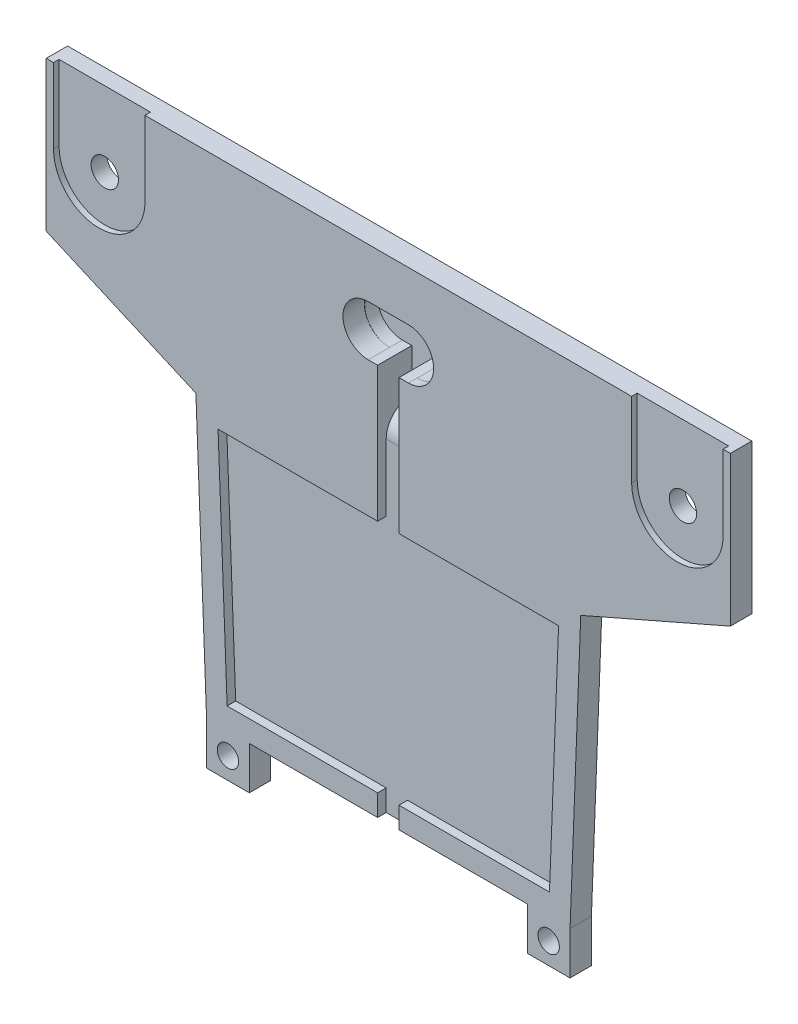
from build123d import *

# Parameters (mm, degrees)
MAIN_BODY_DEPTH          = 6.35
BATTERY_SPACING_DEPTH    = 2.54
SKETCH8_R                = 4.064
LIGHT_SOCKETS_DEPTH      = 12.7
LIGHT_LEADS_POCKET_DEPTH = 6.35
WIRE_TRAIL_DEPTH         = 2.54
LEAD_ROOM_DEPTH          = 7.62
FILLET1_R                = 7.62
TAB_SLOTS_DEPTH          = 1.651
SKETCH14_W               = 12.7
SKETCH14_H               = 6.35
SCREW_MOUNT_DEPTH        = 12.7
CUT_EXTRUDE1_DEPTH       = 179.026641265
CUT_EXTRUDE1_DEPTH_BACK  = 179.026641265
SKETCH15_R               = 3.175


# Sheet-metal steps are written as plain solids
with BuildPart() as part:
    # Sketch1 → Main Body (new body)
    with BuildSketch(Plane.XY):
        Polygon((-53.975, 0), (53.975, 0), (57.15, 82.161327118), (101.6, 101.6), (101.6, 146.05), (-101.6, 146.05), (-101.6, 101.6), (-57.15, 82.161327118), align=None)
    extrude(amount=-MAIN_BODY_DEPTH)

    # Sketch7 → Battery Spacing (cut)
    with BuildSketch(Plane.XY):
        Polygon((-50.564894027, 76.2), (-47.86564661, 6.35), (47.86564661, 6.35), (50.564894027, 76.2), align=None)
    extrude(amount=-BATTERY_SPACING_DEPTH, mode=Mode.SUBTRACT)

    # Sketch8 → Light Sockets (cut)
    with BuildSketch(Plane.XY):
        with Locations((85.852, 123.825)):
            Circle(SKETCH8_R)
        with Locations((-85.852, 123.825)):
            Circle(SKETCH8_R)
        with BuildLine():
            Line((-5.969, 131.318), (5.969, 131.318))
            ThreePointArc((5.969, 131.318), (13.462, 123.825), (5.969, 116.332))
            Line((5.969, 116.332), (-5.969, 116.332))
            ThreePointArc((-5.969, 116.332), (-13.462, 123.825), (-5.969, 131.318))
        make_face()
    extrude(amount=-LIGHT_SOCKETS_DEPTH, mode=Mode.SUBTRACT)

    # Sketch9 → Light Leads Pocket (add)
    with BuildSketch(Plane(origin=(0, 0, -6.35), x_dir=(-1, 0, 0), z_dir=(0, 0, -1))):
        with BuildLine():
            Line((-9.525, 111.765348554), (-9.525, 99.065348554))
            Line((-9.525, 99.065348554), (9.525, 99.065348554))
            Line((9.525, 99.065348554), (9.525, 111.765348554))
            ThreePointArc((9.525, 111.765348554), (18.413001098, 125.621431375), (5.969, 136.398))
            Line((5.969, 136.398), (-5.969, 136.398))
            ThreePointArc((-5.969, 136.398), (-18.413001098, 125.621431375), (-9.525, 111.765348554))
        make_face()
    extrude(amount=LIGHT_LEADS_POCKET_DEPTH)

    # Sketch10 → Wire Trail (cut)
    with BuildSketch(Plane.XY):
        Polygon((-3.175, 116.332), (3.175, 116.332), (3.175, 76.2), (3.175, 6.35), (3.175, 0), (-3.175, 0), align=None)
    extrude(amount=-WIRE_TRAIL_DEPTH, mode=Mode.SUBTRACT)

    # Sketch12 → Lead Room (cut)
    with BuildSketch(Plane.XY.offset(-2.54)):
        with BuildLine():
            Line((-3.175, 116.332), (-5.960094489, 116.332))
            ThreePointArc((-5.960094489, 116.332), (-13.36178344, 123.73368895), (-5.960094489, 131.135377901))
            Line((-5.960094489, 131.135377901), (6.000168296, 131.135377901))
            ThreePointArc((6.000168296, 131.135377901), (13.401857247, 123.73368895), (6.000168296, 116.332))
            Line((6.000168296, 116.332), (3.175, 116.332))
            Line((3.175, 116.332), (3.175, 103.730451358))
            Line((3.175, 103.730451358), (-3.175, 103.730451358))
            Line((-3.175, 103.730451358), (-3.175, 116.332))
        make_face()
    extrude(amount=-LEAD_ROOM_DEPTH, mode=Mode.SUBTRACT)

    # Fillet1
    fillet1_edges = [part.edges().sort_by_distance(p)[0] for p in [
        (0, 103.730451358, -2.54),
    ]]
    fillet(fillet1_edges, radius=FILLET1_R - 0.0001)  # a hair under: the kernel refuses the full size

    # Sketch13 → Tab Slots (cut)
    with BuildSketch(Plane.XY):
        with BuildLine():
            Line((72.263, 146.05), (72.263, 123.825))
            ThreePointArc((72.263, 123.825), (85.852, 110.236), (99.441, 123.825))
            Line((99.441, 123.825), (99.441, 146.05))
            Line((99.441, 146.05), (72.263, 146.05))
        make_face()
    tab_slots = extrude(amount=-TAB_SLOTS_DEPTH, mode=Mode.SUBTRACT)

    # Mirror1: Tab Slots across plane
    add(tab_slots.mirror(Plane(origin=(0, 0, 0), x_dir=(0, 0, 1), z_dir=(1, 0, 0))), mode=Mode.SUBTRACT)

    # Sketch14 → Screw Mount (add)
    with BuildSketch(Plane.XZ):
        with Locations((47.625, -3.175)):
            Rectangle(SKETCH14_W, SKETCH14_H)
    screw_mount = extrude(amount=SCREW_MOUNT_DEPTH)

    # Mirror2: Screw Mount across plane
    add(screw_mount.mirror(Plane(origin=(0, 0, 0), x_dir=(0, 0, 1), z_dir=(1, 0, 0))))

    # Sketch15 → Cut-Extrude1 (cut, two sides: drawn at the far end of the back side and taken through both)
    with BuildSketch(Plane(origin=(0, 0, -6.35), x_dir=(-1, 0, 0), z_dir=(0, 0, -1)).offset(-CUT_EXTRUDE1_DEPTH_BACK)):
        with Locations((47.625, -6.35)):
            Circle(SKETCH15_R)
        with Locations((-47.625, -6.35)):
            Circle(SKETCH15_R)
    extrude(amount=CUT_EXTRUDE1_DEPTH + CUT_EXTRUDE1_DEPTH_BACK, mode=Mode.SUBTRACT)


solid = part.part
